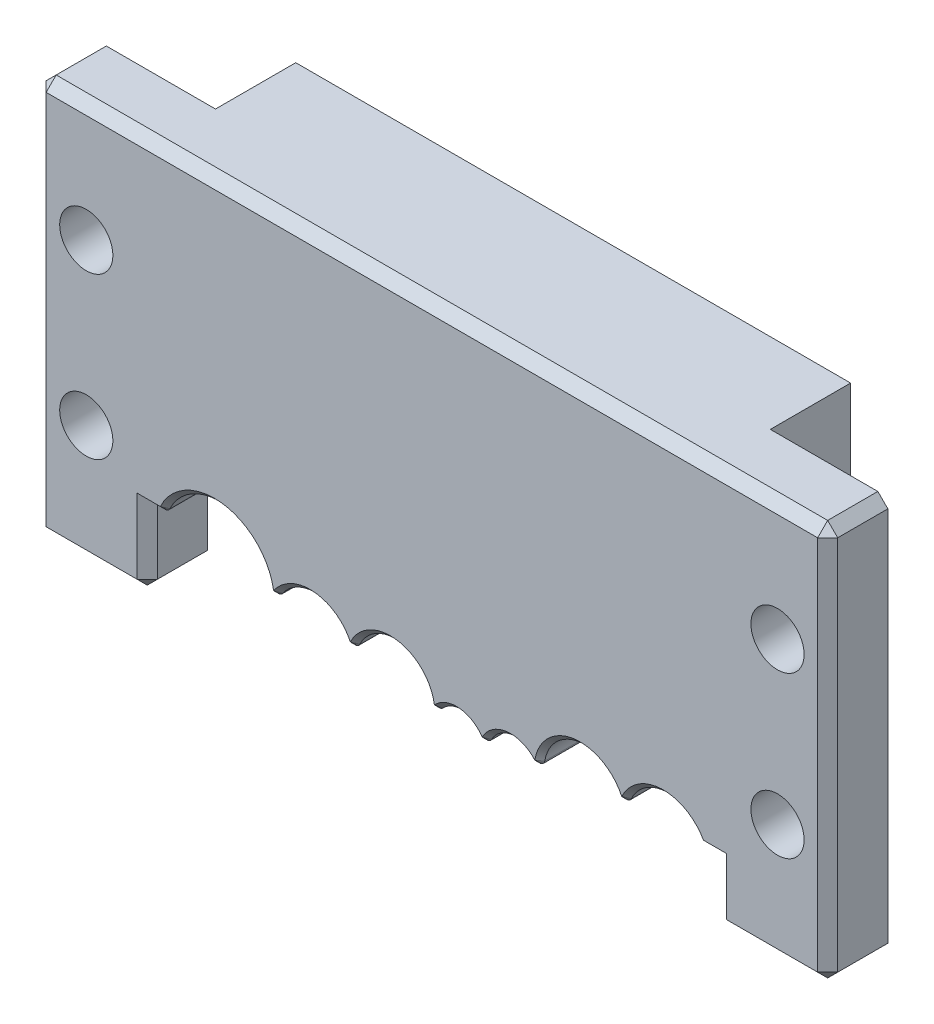
from build123d import *

# Parameters (mm, degrees)
SKETCH3_W           = 78.9
SKETCH3_H           = 32
BOSS_EXTRUDE1_DEPTH = 10
SKETCH3_4_R         = 2.375
CUT_EXTRUDE1_DEPTH  = 8
SKETCH4_W           = 55.14
SKETCH4_H           = 39
BOSS_EXTRUDE2_DEPTH = 6
CUT_EXTRUDE2_REACH  = 66.041
SKETCH9_W           = 78.9
SKETCH9_H           = 10
CUT_EXTRUDE4_DEPTH  = 62.929181295
BOSS_EXTRUDE4_START = -6
SKETCH10_R          = 2.65
BOSS_EXTRUDE4_DEPTH = 6
SKETCH11_W          = 55.305509596
SKETCH11_H          = 8
BOSS_EXTRUDE5_DEPTH = 8
FILLET2_R           = 5
CHAMFER3_SIZE       = 1
CHAMFER4_SIZE       = 0.5


with BuildPart() as part:
    # Sketch3 → Boss-Extrude1 (new body)
    with BuildSketch(Plane(origin=(0, 0, 0), x_dir=(1, 0, 0), z_dir=(0, 1, 0))):
        with Locations((0, 16)):
            Rectangle(SKETCH3_W, SKETCH3_H)
    extrude(amount=BOSS_EXTRUDE1_DEPTH)

    # Sketch3<4> → Cut-Extrude1 (cut)
    with BuildSketch(Plane(origin=(0, 0, 0), x_dir=(1, 0, 0), z_dir=(0, 1, 0))):
        with Locations(Location((-34.45, 9.5, 0), (0, 0, 270))):
            Circle(SKETCH3_4_R)
        with Locations(Location((34.45, 9.5, 0), (0, 0, 270))):
            Circle(SKETCH3_4_R)
        with Locations(Location((-34.45, 25.5, 0), (0, 0, 270))):
            Circle(SKETCH3_4_R)
        with Locations(Location((34.45, 25.5, 0), (0, 0, 270))):
            Circle(SKETCH3_4_R)
    extrude(amount=CUT_EXTRUDE1_DEPTH, mode=Mode.SUBTRACT)

    # Sketch4 → Boss-Extrude2 (add)
    with BuildSketch(Plane.XY):
        with Locations((-0.082754798, -19.5)):
            Rectangle(SKETCH4_W, SKETCH4_H)
    extrude(amount=-BOSS_EXTRUDE2_DEPTH)

    # Sketch6 → Cut-Extrude2 (cut, up to next)
    with BuildSketch(Plane.XY, mode=Mode.PRIVATE) as cut_extrude2_sk1:
        with BuildLine():
            Line((-27.652754798, -39), (27.487245202, -39))
            Line((27.487245202, -39), (27.487245202, -32.795515755))
            ThreePointArc((27.487245202, -32.795515755), (27.113130048, -33.279409344), (26.55063318, -33.039175235))
            ThreePointArc((26.55063318, -33.039175235), (22.840340095, -30.952832292), (19.295797115, -33.309804228))
            ThreePointArc((19.295797115, -33.309804228), (18.842245202, -33.599350759), (18.388693289, -33.309804228))
            ThreePointArc((18.388693289, -33.309804228), (14.135992665, -30.988143783), (10.669672877, -34.373435048))
            ThreePointArc((10.669672877, -34.373435048), (10.313792265, -34.774157145), (9.799721264, -34.622630861))
            ThreePointArc((9.799721264, -34.622630861), (7.44477434, -33.719326103), (5.371236745, -35.155354078))
            ThreePointArc((5.371236745, -35.155354078), (4.951993147, -35.42426536), (4.508475892, -35.197613829))
            ThreePointArc((4.508475892, -35.197613829), (2.60438519, -34.058927341), (0.536516234, -34.862722278))
            ThreePointArc((0.536516234, -34.862722278), (0.021886532, -35.001511273), (-0.325508515, -34.597255418))
            ThreePointArc((-0.325508515, -34.597255418), (-3.632594875, -31.292369955), (-7.755777397, -33.496560058))
            ThreePointArc((-7.755777397, -33.496560058), (-8.207754798, -33.782746053), (-8.659732199, -33.496560058))
            ThreePointArc((-8.659732199, -33.496560058), (-11.896894258, -31.262329464), (-15.446236111, -32.95737429))
            ThreePointArc((-15.446236111, -32.95737429), (-15.968076529, -33.16278259), (-16.352419433, -32.754382635))
            ThreePointArc((-16.352419433, -32.754382635), (-20.981382663, -28.205325535), (-26.701290363, -31.271899679))
            ThreePointArc((-26.701290363, -31.271899679), (-27.262908741, -31.544719865), (-27.652754798, -31.057004673))
            Line((-27.652754798, -31.057004673), (-27.652754798, -39))
        make_face()
    cut_extrude2_tool1 = extrude(cut_extrude2_sk1.sketch, amount=-CUT_EXTRUDE2_REACH, mode=Mode.PRIVATE) & part.part
    add(cut_extrude2_tool1.solids().sort_by_distance((-1.936265, -35.219125, 0))[0], mode=Mode.SUBTRACT)

    # Sketch9 → Cut-Extrude4 (cut, through all)
    with BuildSketch(Plane.XY):
        with Locations((0, 5)):
            Rectangle(SKETCH9_W, SKETCH9_H)
    extrude(amount=-CUT_EXTRUDE4_DEPTH, mode=Mode.SUBTRACT)

    # Sketch10 → Boss-Extrude4 (add)
    # profile 1 of 2: a face of its own
    with BuildSketch(Plane(origin=(0, 0, -6), x_dir=(-1, 0, 0), z_dir=(0, 0, -1)).offset(BOSS_EXTRUDE4_START)):
        with BuildLine():
            Line((-27.487245202, 0), (-39.367245202, 0))
            Line((-39.367245202, 0), (-39.367245202, -39.5))
            Line((-39.367245202, -39.5), (-28.287245202, -39.5))
            Line((-28.287245202, -39.5), (-28.287245202, -33.295515755))
            Line((-28.287245202, -33.295515755), (-26.987245202, -33.295515755))
            ThreePointArc((-26.987245202, -33.295515755), (-27.340798593, -33.149069145), (-27.487245202, -32.795515755))
            Line((-27.487245202, -32.795515755), (-27.487245202, 0))
        make_face()
        with Locations((-34.367245202, -11.75)):
            Circle(SKETCH10_R, mode=Mode.SUBTRACT)
        with Locations((-34.367245202, -27.75)):
            Circle(SKETCH10_R, mode=Mode.SUBTRACT)
    # profile 2 of 2: a face of its own
    with BuildSketch(Plane(origin=(0, 0, -6), x_dir=(-1, 0, 0), z_dir=(0, 0, -1)).offset(BOSS_EXTRUDE4_START)):
        with BuildLine():
            Line((27.652754798, 0), (39.532754798, 0))
            Line((39.532754798, 0), (39.532754798, -39.5))
            Line((39.532754798, -39.5), (28.452754798, -39.5))
            Line((28.452754798, -39.5), (28.452754798, -31.557004673))
            Line((28.452754798, -31.557004673), (27.152754798, -31.557004673))
            ThreePointArc((27.152754798, -31.557004673), (27.506308189, -31.410558063), (27.652754798, -31.057004673))
            Line((27.652754798, -31.057004673), (27.652754798, 0))
        make_face()
        with Locations((34.532754798, -11.75)):
            Circle(SKETCH10_R, mode=Mode.SUBTRACT)
        with Locations((34.532754798, -27.75)):
            Circle(SKETCH10_R, mode=Mode.SUBTRACT)
    extrude(amount=BOSS_EXTRUDE4_DEPTH)

    # Sketch11 → Boss-Extrude5 (add)
    with BuildSketch(Plane.XY):
        with Locations((0, -4)):
            Rectangle(SKETCH11_W, SKETCH11_H)
    extrude(amount=BOSS_EXTRUDE5_DEPTH)

    # Fillet2
    fillet2_edges = [part.edges().sort_by_distance(p)[0] for p in [
        (0, -8, 0),
    ]]
    fillet(fillet2_edges, radius=FILLET2_R)

    # Chamfer3
    chamfer3_edges = [part.edges().sort_by_distance(p)[0] for p in [
        (28.287245202, -39.5, -3),
        (39.367245202, -39.5, -3),
        (39.367245202, 0, -3),
        (39.367245202, -19.75, -6),
        (33.827245202, -39.5, -6),
        (28.287245202, -36.397757877, -6),
        (-39.532754798, 0, -3),
        (-39.532754798, -39.5, -3),
        (-28.452754798, -39.5, -3),
        (-28.452754798, -35.528502336, -6),
        (-33.992754798, -39.5, -6),
        (-39.532754798, -19.75, -6),
        (-0.082754798, 0, -6),
    ]]
    chamfer(chamfer3_edges, length=CHAMFER3_SIZE)

    # Chamfer4
    chamfer4_edges = [part.edges().sort_by_distance(p)[0] for p in [
        (26.734094792, -33.226694221, 0),
        (26.734094792, -33.226694221, -6),
        (27.637245202, -33.295515755, 0),
        (28.137245202, -33.295515755, -6),
        (-27.802754798, -31.557004673, 0),
        (-28.302754798, -31.557004673, -6),
        (-15.968076529, -33.16278259, -6),
        (-11.896894258, -31.262329464, -6),
        (-8.207754798, -33.782746053, -6),
        (-3.632594875, -31.292369955, -6),
        (0.021886532, -35.001511273, -6),
        (2.60438519, -34.058927341, -6),
        (4.951993147, -35.42426536, -6),
        (7.44477434, -33.719326103, -6),
        (10.313792265, -34.774157145, -6),
        (14.135992665, -30.988143783, -6),
        (18.842245202, -33.599350759, -6),
        (22.840340095, -30.952832292, -6),
        (-26.885778679, -31.479761993, -6),
        (-20.981382663, -28.205325535, -6),
        (-15.968076529, -33.16278259, 0),
        (-20.981382663, -28.205325535, 0),
        (-26.885778679, -31.479761993, 0),
        (22.840340095, -30.952832292, 0),
        (18.842245202, -33.599350759, 0),
        (14.135992665, -30.988143783, 0),
        (10.313792265, -34.774157145, 0),
        (7.44477434, -33.719326103, 0),
        (4.951993147, -35.42426536, 0),
        (2.60438519, -34.058927341, 0),
        (0.021886532, -35.001511273, 0),
        (-3.632594875, -31.292369955, 0),
        (-8.207754798, -33.782746053, 0),
        (-11.896894258, -31.262329464, 0),
    ]]
    chamfer(chamfer4_edges, length=CHAMFER4_SIZE - 0.0001)  # a hair under: the kernel refuses the full size


with BuildPart() as body_2:
    # Mirror1: mirrored copy
    add(part.part.mirror(Plane(origin=(39.45, 10, 0), x_dir=(1, 0, 0), z_dir=(0, 0, 1))))


solid = body_2.part
